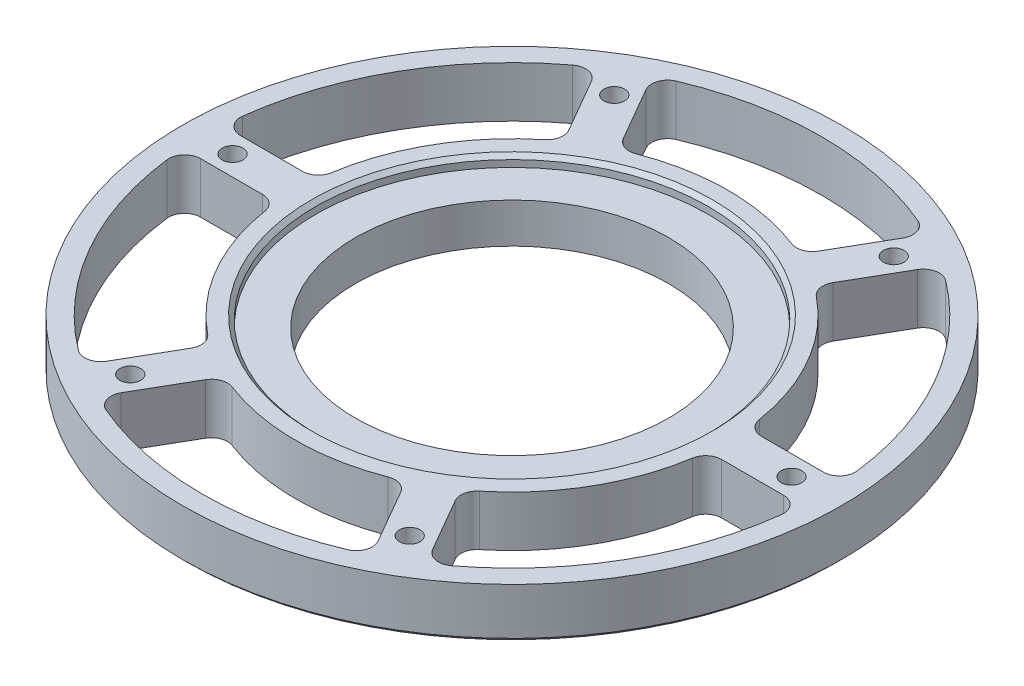
from build123d import *

# Parameters (mm, degrees)
F_6_0_204_DIAMETER_HOLE1_D = 5.1816
CIRPATTERN3_COUNT          = 6
CUT_EXTRUDE1_DEPTH         = 118.43208675655899
FILLET1_R                  = 4
CIRPATTERN4_COUNT          = 6
FILLET1_OF_CIRPATTERN4_R   = 4
CHAMFER1_SIZE              = 1
CHAMFER2_SIZE              = 1


with BuildPart() as part:
    # Sketch2 → Revolve1 (revolve)
    with BuildSketch(Plane(origin=(0, 0, 0), x_dir=(0, 0, -1), z_dir=(1, 0, 0))):
        Polygon((-39.2125, -8.7e-16), (-82.55, -5.31e-15), (-82.55, 12.699999999999994), (-49.2125, 12.699999999999994), (-49.21250000000001, 9.999999999999998), (-39.21250000000001, 9.999999999999998), align=None)
    revolve(axis=Axis((0, -0.9525000000000071, 0), (0, 1, 0)))

    # #6 (0.204) Diameter Hole1 (through all)
    with Locations(Plane(origin=(0, 12.699999999999994, 0), x_dir=(1, 0, 0), z_dir=(0, 1, 0))):
        with Locations((-35, 60.621778265)):
            f_6_0_204_diameter_hole1 = Hole(F_6_0_204_DIAMETER_HOLE1_D / 2)

    # CirPattern3: #6 (0.204) Diameter Hole1 ×6 about axis
    cirpattern3_axis = Axis((0, -0.9525000000000071, 0), (0, 1, 0))
    for i in range(1, CIRPATTERN3_COUNT):
        add(f_6_0_204_diameter_hole1.rotate(cirpattern3_axis, i * 360 / CIRPATTERN3_COUNT), mode=Mode.SUBTRACT)

    # Sketch8 → Cut-Extrude1 (cut, through all)
    with BuildSketch(Plane(origin=(0, 12.699999999999994, 0), x_dir=(1, 0, 0), z_dir=(0, 1, 0))):
        with BuildLine():
            Line((-34.36419588509058, 69.52053323422601), (-22.660589701137393, 49.249292691841845))
            ThreePointArc((-22.660589701137393, 49.249292691841845), (3.32e-15, 54.212500000000006), (22.660589701137393, 49.249292691841845))
            Line((22.660589701137393, 49.249292691841845), (34.36419588509058, 69.52053323422601))
            ThreePointArc((34.36419588509058, 69.52053323422601), (4.75e-15, 77.55), (-34.36419588509058, 69.52053323422601))
        make_face()
    cut_extrude1 = extrude(amount=-CUT_EXTRUDE1_DEPTH, mode=Mode.SUBTRACT)

    # Fillet1
    fillet1_edges = [part.edges().sort_by_distance(p)[0] for p in [
        (34.36419588509058, 6.349999999999996, -69.52053323422601),
        (22.660589701137397, 6.349999999999996, -49.249292691841845),
        (-34.36419588509059, 6.349999999999996, -69.52053323422601),
        (-22.660589701137393, 6.349999999999996, -49.249292691841845),
    ]]
    fillet(fillet1_edges, radius=FILLET1_R)

    # CirPattern4: Cut-Extrude1 ×6 about axis
    cirpattern4_axis = Axis((0, -0.9525000000000071, 0), (0, 1, 0))
    for i in range(1, CIRPATTERN4_COUNT):
        add(cut_extrude1.rotate(cirpattern4_axis, i * 360 / CIRPATTERN4_COUNT), mode=Mode.SUBTRACT)

    # Fillet1 of CirPattern4
    fillet1_of_cirpattern4_edges = [part.edges().sort_by_distance(p)[0] for p in [
        (-43.024449922934764, 6.349999999999996, -64.52053323422612),
        (-31.320843738981637, 6.349999999999996, -44.24929269184193),
        (-77.38864580802536, 6.349999999999996, -4.99999999999989),
        (-53.981433440119034, 6.349999999999996, -4.999999999999929),
        (-77.38864580802536, 6.349999999999996, 4.999999999999872),
        (-53.981433440119034, 6.349999999999996, 4.999999999999904),
        (-43.02444992293478, 6.349999999999996, 64.52053323422612),
        (-31.32084373898165, 6.349999999999996, 44.249292691841916),
        (-34.36419588509059, 6.349999999999996, 69.52053323422601),
        (-22.660589701137404, 6.349999999999996, 49.249292691841845),
        (34.36419588509058, 6.349999999999996, 69.52053323422601),
        (22.660589701137386, 6.349999999999996, 49.249292691841845),
        (43.02444992293474, 6.349999999999996, 64.52053323422614),
        (31.320843738981612, 6.349999999999996, 44.249292691841944),
        (77.38864580802536, 6.349999999999996, 4.999999999999922),
        (53.98143344011903, 6.349999999999996, 4.999999999999947),
        (77.38864580802536, 6.349999999999996, -4.999999999999897),
        (53.981433440119034, 6.349999999999996, -4.999999999999925),
        (43.024449922934764, 6.349999999999996, -64.52053323422614),
        (31.320843738981637, 6.349999999999996, -44.24929269184193),
    ]]
    fillet(fillet1_of_cirpattern4_edges, radius=FILLET1_OF_CIRPATTERN4_R)

    # Chamfer1
    chamfer1_edges = [part.edges().sort_by_distance(p)[0] for p in [
        (6.03e-15, 12.699999999999994, -49.2125),
    ]]
    chamfer(chamfer1_edges, length=CHAMFER1_SIZE)

    # Chamfer2
    chamfer2_edges = [part.edges().sort_by_distance(p)[0] for p in [
        (4.677e-14, -5.33e-15, -82.55),
    ]]
    chamfer(chamfer2_edges, length=CHAMFER2_SIZE)


solid = part.part
